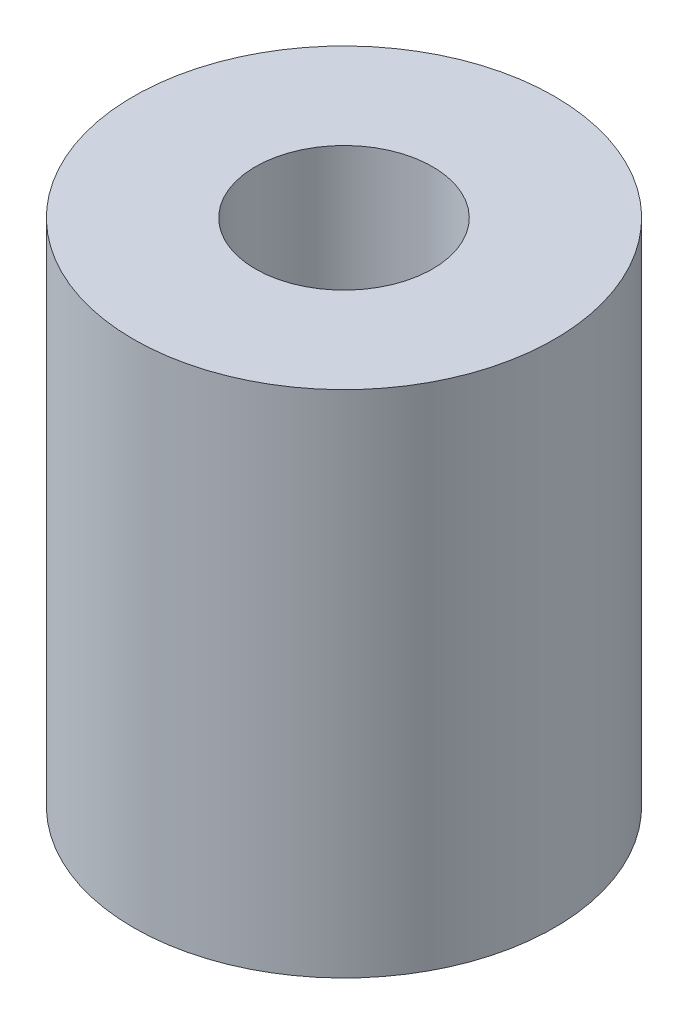
from build123d import *

# Parameters (mm, degrees)
SKETCH1_R           = 9.5
SKETCH1_R_2         = 2.5
BOSS_EXTRUDE1_DEPTH = 23
SKETCH2_R           = 4
CUT_EXTRUDE1_DEPTH  = 12


with BuildPart() as part:
    # Sketch1 → Boss-Extrude1 (new body)
    with BuildSketch(Plane(origin=(0, 0, 0), x_dir=(1, 0, 0), z_dir=(0, 1, 0))):
        Circle(SKETCH1_R)
        Circle(SKETCH1_R_2, mode=Mode.SUBTRACT)
    extrude(amount=BOSS_EXTRUDE1_DEPTH)

    # Sketch2 → Cut-Extrude1 (cut)
    with BuildSketch(Plane(origin=(0, 23, 0), x_dir=(1, 0, 0), z_dir=(0, 1, 0))):
        Circle(SKETCH2_R)
    extrude(amount=-CUT_EXTRUDE1_DEPTH, mode=Mode.SUBTRACT)


solid = part.part
